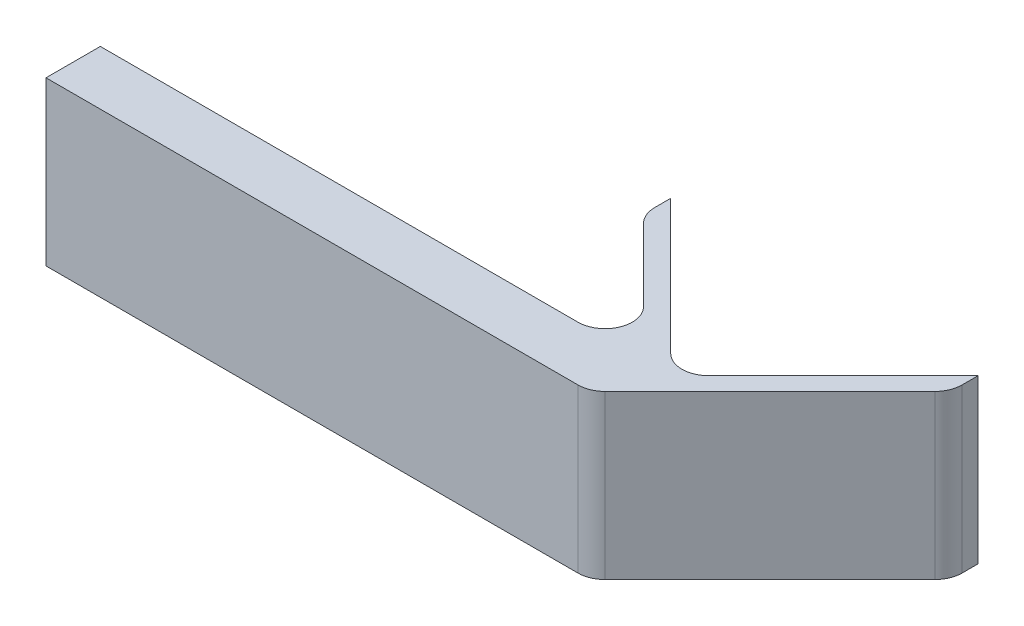
from build123d import *

# Parameters (mm, degrees)
BOSS_EXTRUDE3_DEPTH = 30
FILLET7_R           = 5
FILLET8_R           = 5
FILLET9_R           = 5
FILLET10_R          = 5


with BuildPart() as part:
    # Sketch1 → Boss-Extrude3 (new body)
    with BuildSketch(Plane(origin=(0, 0, 0), x_dir=(1, 0, 0), z_dir=(0, 1, 0))):
        Polygon((-75, 0), (-75, 10), (25, 10), (1.715728753, 33.284271247), (1.715728753, 38.284271247), (30, 10), (58.284271247, 38.284271247), (58.284271247, 33.284271247), (35, 10), (25, 0), align=None)
    extrude(amount=BOSS_EXTRUDE3_DEPTH)

    # Fillet7
    fillet7_edges = [part.edges().sort_by_distance(p)[0] for p in [
        (30, 15, -10),
    ]]
    fillet(fillet7_edges, radius=FILLET7_R)

    # Fillet8
    fillet8_edges = [part.edges().sort_by_distance(p)[0] for p in [
        (25, 15, -10),
    ]]
    fillet(fillet8_edges, radius=FILLET8_R)

    # Fillet9
    fillet9_edges = [part.edges().sort_by_distance(p)[0] for p in [
        (58.284271247, 15, -33.284271247),
        (1.715728753, 15, -33.284271247),
    ]]
    fillet(fillet9_edges, radius=FILLET9_R)

    # Fillet10
    fillet10_edges = [part.edges().sort_by_distance(p)[0] for p in [
        (25, 15, 0),
    ]]
    fillet(fillet10_edges, radius=FILLET10_R)


solid = part.part
